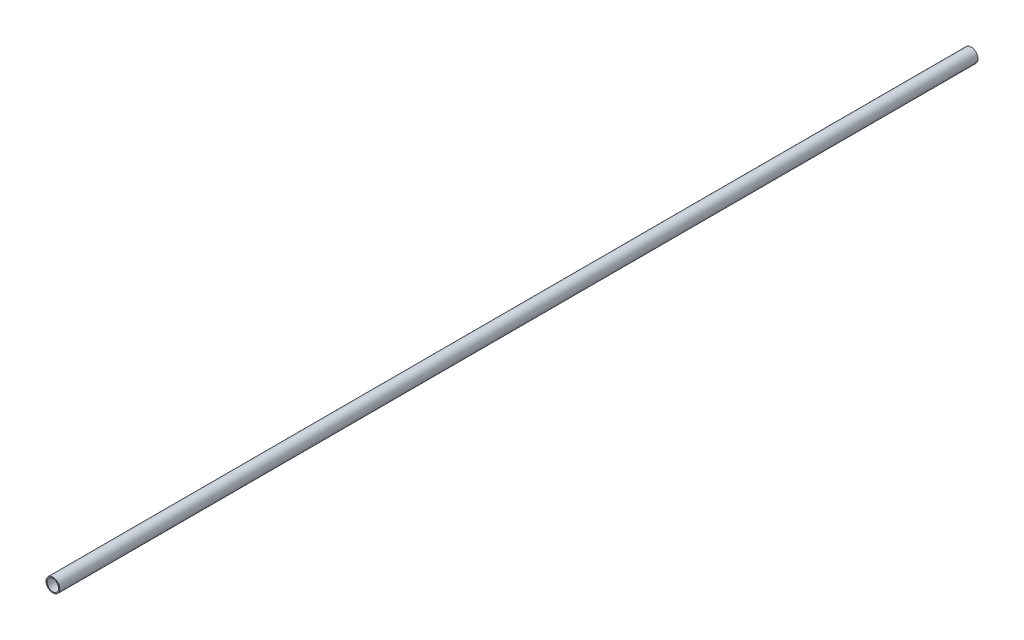
from build123d import *

# Parameters (mm, degrees)
SKETCH1_R           = 3
SKETCH1_R_2         = 2.5
BOSS_EXTRUDE1_DEPTH = 200.025


with BuildPart() as part:
    # Sketch1 → Boss-Extrude1 (new, symmetric)
    with BuildSketch(Plane.XY):
        Circle(SKETCH1_R)
        Circle(SKETCH1_R_2, mode=Mode.SUBTRACT)
    extrude(amount=BOSS_EXTRUDE1_DEPTH, both=True)


solid = part.part
